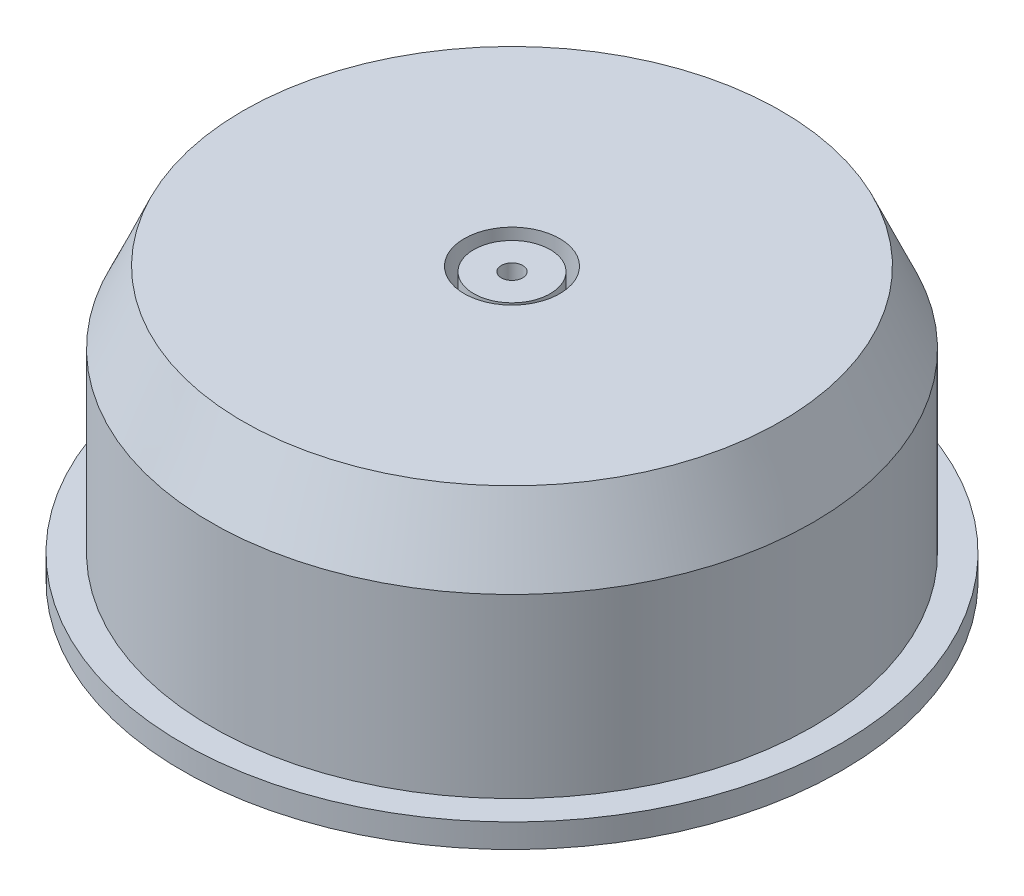
from build123d import *

# Parameters (mm, degrees)
EXTRUDE_START            = 27
SKETCH_3_R               = 8
EXTRUDE_1_DEPTH          = 27
SKETCH_4_W               = 21.869380784
SKETCH_4_H               = 6.809627549
CUT_EXTRUDE_1_DEPTH      = 23
SKETCH_5_R               = 3.5
CUT_EXTRUDE_2_DEPTH      = 70
PATTERN_CIRCULAR_1_COUNT = 6
HOLE_WIZARD_M41_D        = 4.5
HOLE_WIZARD_M41_DEPTH    = 14
HOLE_WIZARD_M41_TIP      = 1.351936393
SKETCH_14_R              = 9.95061624
SKETCH_14_R_2            = 8
CUT_EXTRUDE_5_DEPTH      = 10


with BuildPart() as part:
    # Эскиз2 → Повернуть1 (revolve)
    with BuildSketch(Plane.XY):
        Polygon((-10, -1.978246769), (-56.333333333, -1.978246769), (-63, -16.978246769), (-63, -53.978246769), (-69, -53.978246769), (-69, -58.978246769), (-34.298944769, -58.978246769), (-25.298944769, -62.978246769), (0, -62.978246769), (0, -2.978246769), (-8, -2.978246769), (-8, -13.730591033), (-10, -13.730591033), align=None)
    revolve(axis=Axis((0, -2.978246769, 0), (0, -1, 0)))

    # Эскиз3 → Бобышка-Вытянуть1 (add)
    with BuildSketch(Plane.XZ.offset(62.978246769).offset(EXTRUDE_START)):
        Circle(SKETCH_3_R)
    extrude(amount=-EXTRUDE_1_DEPTH)

    # Эскиз4 → Вырез-Вытянуть1 (cut)
    with BuildSketch(Plane.XZ.offset(89.978246769)):
        with Locations((-0.065477188, 8.404813774)):
            Rectangle(SKETCH_4_W, SKETCH_4_H)
    extrude(amount=-CUT_EXTRUDE_1_DEPTH, mode=Mode.SUBTRACT)

    # Эскиз5 → Вырез-Вытянуть2 (cut)
    with BuildSketch(Plane.XZ.offset(89.978246769)):
        Circle(SKETCH_5_R)
    extrude(amount=-CUT_EXTRUDE_2_DEPTH, mode=Mode.SUBTRACT)

    # Эскиз7 → Зенковка для винта с полупотайной головкой M51 (revolve, cut)
    with BuildSketch(Plane(origin=(-1.157683247, -58.978246769, -60), x_dir=(0, 0, -1), z_dir=(1, 0, 0))):
        Polygon((0, 0), (0, 15.652366702), (2.75, 14), (2.75, 2.45), (5.2, 0), align=None)
    hole_wizard_m51 = revolve(axis=Axis((-1.157683247, -65.328246769, -60), (0, 1, 0)), mode=Mode.SUBTRACT)

    # Круговой массив1: Зенковка для винта с полупотайной головкой M51 ×6 about axis
    pattern_circular_1_axis = Axis((0, -58.978246769, 0), (0, 1, 0))
    for i in range(1, PATTERN_CIRCULAR_1_COUNT):
        add(hole_wizard_m51.rotate(pattern_circular_1_axis, i * 360 / PATTERN_CIRCULAR_1_COUNT), mode=Mode.SUBTRACT)

    # Отверстие с зазором M41
    with Locations(Plane(origin=(0, -2.978246769, 0), x_dir=(1, 0, 0), z_dir=(0, 1, 0))):
        with Locations((0, 0)):
            Hole(HOLE_WIZARD_M41_D / 2, depth=HOLE_WIZARD_M41_DEPTH)
            with Locations((0, 0, -(HOLE_WIZARD_M41_DEPTH + HOLE_WIZARD_M41_TIP / 2))):  # 118° drill point
                Cone(0, HOLE_WIZARD_M41_D / 2, HOLE_WIZARD_M41_TIP, mode=Mode.SUBTRACT)

    # Эскиз14 → Вырез-Вытянуть5 (cut)
    with BuildSketch(Plane.XZ.offset(62.978246769)):
        Circle(SKETCH_14_R)
        Circle(SKETCH_14_R_2, mode=Mode.SUBTRACT)
    extrude(amount=-CUT_EXTRUDE_5_DEPTH, mode=Mode.SUBTRACT)


solid = part.part
